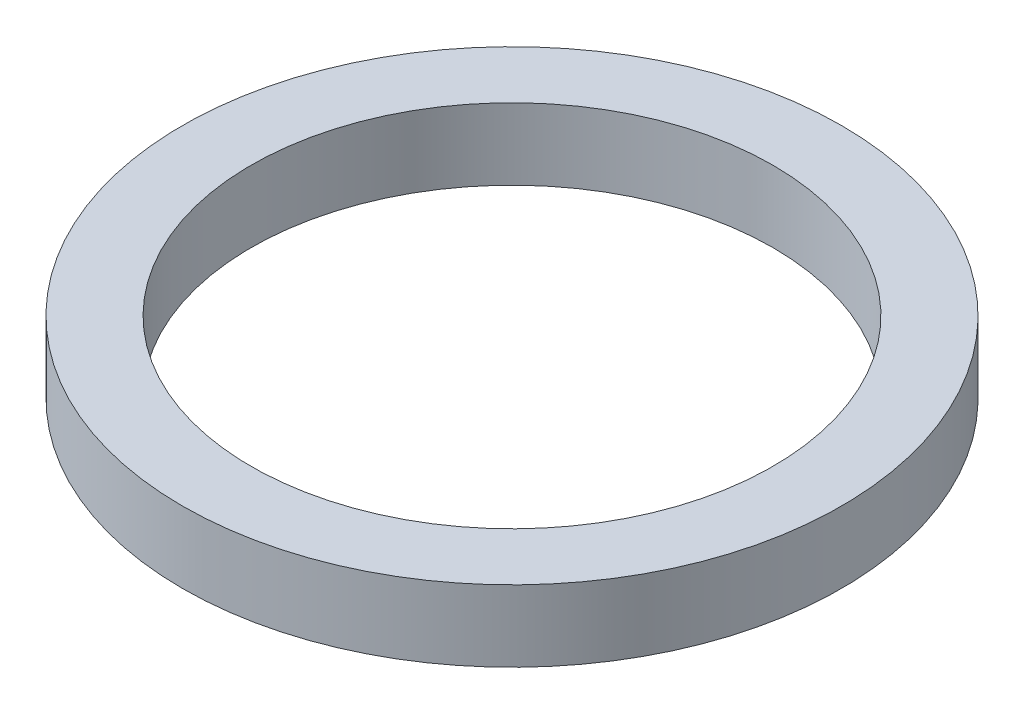
from build123d import *

# Parameters (mm, degrees)
SKETCH1_R           = 60
BOSS_EXTRUDE1_DEPTH = 13
SKETCH2_R           = 47.5
CUT_EXTRUDE1_DEPTH  = 86.842879728


with BuildPart() as part:
    # Sketch1 → Boss-Extrude1 (new body)
    with BuildSketch(Plane(origin=(0, 0, 0), x_dir=(1, 0, 0), z_dir=(0, 1, 0))):
        Circle(SKETCH1_R)
    extrude(amount=BOSS_EXTRUDE1_DEPTH)

    # Sketch2 → Cut-Extrude1 (cut, through all)
    with BuildSketch(Plane(origin=(0, 0, 0), x_dir=(1, 0, 0), z_dir=(0, 1, 0))):
        Circle(SKETCH2_R)
    extrude(amount=CUT_EXTRUDE1_DEPTH, mode=Mode.SUBTRACT)


solid = part.part
